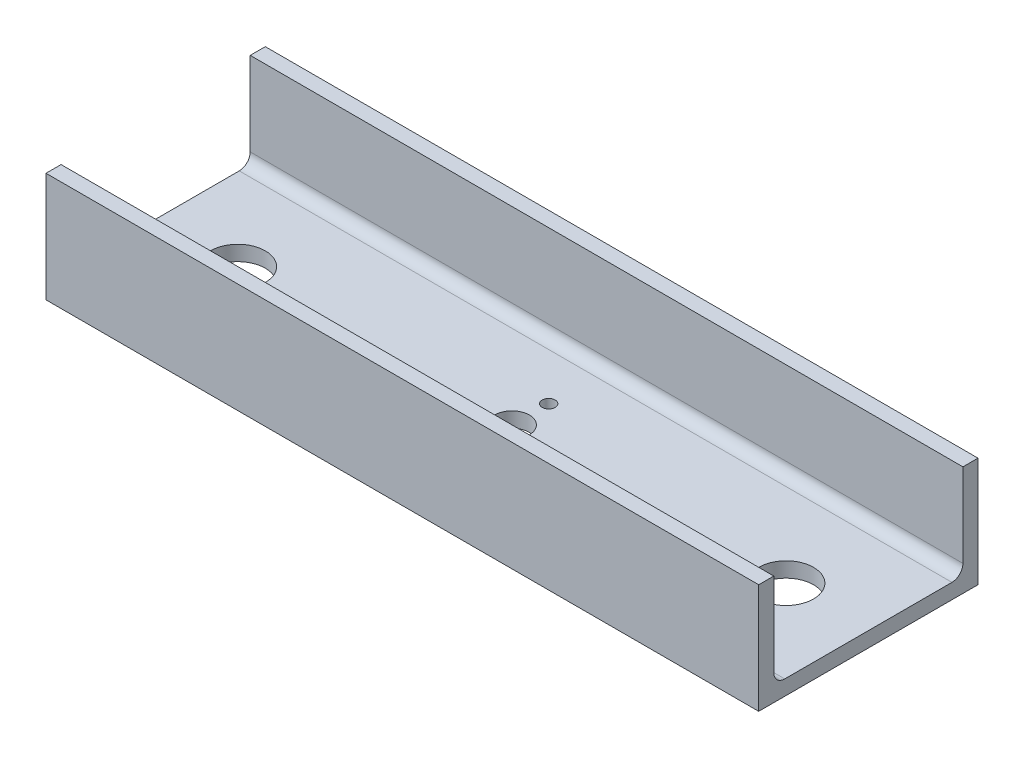
from build123d import *

# Parameters (mm, degrees)
BOSS_EXTRUDE1_DEPTH = 165.1
SKETCH2_R           = 6.35
SKETCH2_R_2         = 1.5
SKETCH2_R_3         = 4
CUT_EXTRUDE1_DEPTH  = 11.938
CUT_EXTRUDE2_DEPTH  = 7.874


with BuildPart() as part:
    # Sketch1 → Boss-Extrude1 (new body)
    with BuildSketch(Plane(origin=(0, 0, 0), x_dir=(0, 0, -1), z_dir=(1, 0, 0))):
        with BuildLine():
            Line((-21.9075, -6.6675), (-21.9075, 9.2075))
            Line((-21.9075, 9.2075), (-21.9075, 12.7))
            Line((-21.9075, 12.7), (-25.4, 12.7))
            Line((-25.4, 12.7), (-25.4, -12.7))
            Line((-25.4, -12.7), (25.4, -12.7))
            Line((25.4, -12.7), (25.4, 12.7))
            Line((25.4, 12.7), (21.9075, 12.7))
            Line((21.9075, 12.7), (21.9075, 9.2075))
            Line((21.9075, 9.2075), (21.9075, -6.6675))
            ThreePointArc((21.9075, -6.6675), (21.163551224, -8.463551224), (19.3675, -9.2075))
            Line((19.3675, -9.2075), (-19.3675, -9.2075))
            ThreePointArc((-19.3675, -9.2075), (-21.163551224, -8.463551224), (-21.9075, -6.6675))
        make_face()
    extrude(amount=BOSS_EXTRUDE1_DEPTH)

    # Sketch2 → Cut-Extrude1 (cut)
    with BuildSketch(Plane.XZ.offset(12.7)):
        with Locations((19.05, 0)):
            Circle(SKETCH2_R)
        with Locations((146.05, 0)):
            Circle(SKETCH2_R)
        with Locations((82.55, 8.5)):
            Circle(SKETCH2_R_2)
        with Locations((82.55, -8.5)):
            Circle(SKETCH2_R_2)
        with Locations((82.55, 0)):
            Circle(SKETCH2_R_3)
    extrude(amount=-CUT_EXTRUDE1_DEPTH, mode=Mode.SUBTRACT)

    # Sketch3 → Cut-Extrude2 (cut)
    with BuildSketch(Plane.XZ.offset(12.7)):
        with BuildLine():
            ThreePointArc((52.9, 19.572413762), (50.8, 21.672413762), (48.7, 19.572413762))
            Line((48.7, 19.572413762), (48.7, 13.222413762))
            ThreePointArc((48.7, 13.222413762), (50.8, 11.122413762), (52.9, 13.222413762))
            Line((52.9, 13.222413762), (52.9, 19.572413762))
        make_face()
        with BuildLine():
            ThreePointArc((116.4, 19.572413762), (114.3, 21.672413762), (112.2, 19.572413762))
            Line((112.2, 19.572413762), (112.2, 13.222413762))
            ThreePointArc((112.2, 13.222413762), (114.3, 11.122413762), (116.4, 13.222413762))
            Line((116.4, 13.222413762), (116.4, 19.572413762))
        make_face()
    extrude(amount=-CUT_EXTRUDE2_DEPTH, mode=Mode.SUBTRACT)


solid = part.part
